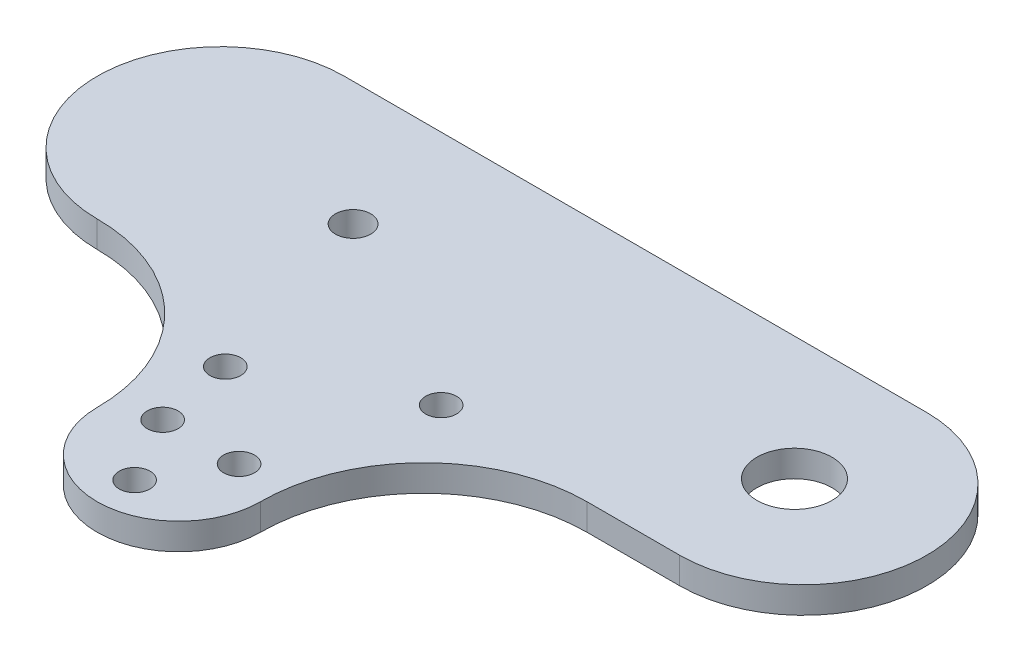
from build123d import *

# Parameters (mm, degrees)
SKETCH_1_W          = 80
SKETCH_1_H          = 28
SKETCH_1_R          = 4.25
SKETCH_1_R_2        = 2
EXTRUDE_1_DEPTH     = 3
FILLET_2_RADIUS     = 14
FILLET_2_LENGTH     = 3
EXTRUDE_3_DEPTH     = 3
SKETCH_5_W          = 18.5
SKETCH_5_H          = 18.5
EXTRUDE_4_DEPTH     = 3
FILLET_3_R          = 18.5
EXTRUDE_5_DEPTH     = 3
CUT_EXTRUDE_1_REACH = 70.323
SKETCH_10_R         = 1.75


with BuildPart() as part:
    # 草图1 → 凸台-拉伸1 (new body)
    with BuildSketch(Plane(origin=(0, 0, 0), x_dir=(1, 0, 0), z_dir=(0, 1, 0))):
        Rectangle(SKETCH_1_W, SKETCH_1_H)
        with Locations(Location((25, 0, 0), (0, 0, 270))):
            Circle(SKETCH_1_R, mode=Mode.SUBTRACT)
        with Locations(Location((-25, 0, 0), (0, 0, 270))):
            Circle(SKETCH_1_R_2, mode=Mode.SUBTRACT)
    extrude(amount=EXTRUDE_1_DEPTH)

    # 圆角2: full round fillet: the end face becomes a half cylinder, R = half its width
    fillet_2_face = Plane((40, 1.5, 0), x_dir=(0, -1, 0), z_dir=(1, 0, 0))  # on the end face: x along it, z out of the body
    fillet_2_slab = fillet_2_face.offset(-FILLET_2_RADIUS / 2) * Box(FILLET_2_LENGTH, 2 * FILLET_2_RADIUS, FILLET_2_RADIUS, mode=Mode.PRIVATE)  # the body's end, R deep
    fillet_2_round = Plane((26, 1.5, 0), x_dir=(1, 0, 0), z_dir=(0, -1, 0)) * Cylinder(FILLET_2_RADIUS, FILLET_2_LENGTH, mode=Mode.PRIVATE)  # its axis R under the face
    add(fillet_2_slab - fillet_2_round, mode=Mode.SUBTRACT)

    # 草图4 → 凸台-拉伸3 (add)
    with BuildSketch(Plane.XZ):
        with BuildLine():
            Line((-40, 14), (-40, -14))
            ThreePointArc((-40, -14), (-54, 0), (-40, 14))
        make_face()
    extrude(amount=-EXTRUDE_3_DEPTH)

    # 草图5 → 凸台-拉伸4 (add)
    with BuildSketch(Plane(origin=(0, 0, 0), x_dir=(-1, 0, 0), z_dir=(0, -1, 0))):
        with Locations((12.25, -23.25)):
            Rectangle(SKETCH_5_W, SKETCH_5_H)
    extrude(amount=-EXTRUDE_4_DEPTH)

    # 圆角3
    fillet_3_edges = [part.edges().sort_by_distance(p)[0] for p in [
        (-21.5, 1.5, 14),
        (-3, 1.5, 14),
    ]]
    fillet(fillet_3_edges, radius=FILLET_3_R - 0.0001)  # a hair under: the kernel refuses the full size

    # 草图6 → 凸台-拉伸5 (add)
    with BuildSketch(Plane.XZ):
        with BuildLine():
            Line((-21.5, 32.5), (-3, 32.5))
            ThreePointArc((-3, 32.5), (-12.25, 41.75), (-21.5, 32.5))
        make_face()
    extrude(amount=-EXTRUDE_5_DEPTH)

    # 草图10 → 切除-拉伸1 (cut, up to next)
    with BuildSketch(Plane.XZ, mode=Mode.PRIVATE) as cut_extrude_1_sk1:
        with Locations(Location((-12.25, 37.5, 0), (0, 0, 270))):
            Circle(SKETCH_10_R)
    cut_extrude_1_tool1 = extrude(cut_extrude_1_sk1.sketch, amount=-CUT_EXTRUDE_1_REACH, mode=Mode.PRIVATE) & part.part
    # 草图10 → 切除-拉伸1 (cut, up to next)
    with BuildSketch(Plane.XZ, mode=Mode.PRIVATE) as cut_extrude_1_sk2:
        with Locations(Location((-7.919872981, 30, 0), (0, 0, 270))):
            Circle(SKETCH_10_R)
    cut_extrude_1_tool2 = extrude(cut_extrude_1_sk2.sketch, amount=-CUT_EXTRUDE_1_REACH, mode=Mode.PRIVATE) & part.part
    # 草图10 → 切除-拉伸1 (cut, up to next)
    with BuildSketch(Plane.XZ, mode=Mode.PRIVATE) as cut_extrude_1_sk3:
        with Locations(Location((-16.580127019, 30, 0), (0, 0, 270))):
            Circle(SKETCH_10_R)
    cut_extrude_1_tool3 = extrude(cut_extrude_1_sk3.sketch, amount=-CUT_EXTRUDE_1_REACH, mode=Mode.PRIVATE) & part.part
    # 草图10 → 切除-拉伸1 (cut, up to next)
    with BuildSketch(Plane.XZ, mode=Mode.PRIVATE) as cut_extrude_1_sk4:
        with Locations(Location((-18.244078093, 21.233684631, 0), (0, 0, 270))):
            Circle(SKETCH_10_R)
    cut_extrude_1_tool4 = extrude(cut_extrude_1_sk4.sketch, amount=-CUT_EXTRUDE_1_REACH, mode=Mode.PRIVATE) & part.part
    # 草图10 → 切除-拉伸1 (cut, up to next)
    with BuildSketch(Plane.XZ, mode=Mode.PRIVATE) as cut_extrude_1_sk5:
        with Locations(Location((-2.240350538, 12.7860315, 0), (0, 0, 270))):
            Circle(SKETCH_10_R)
    cut_extrude_1_tool5 = extrude(cut_extrude_1_sk5.sketch, amount=-CUT_EXTRUDE_1_REACH, mode=Mode.PRIVATE) & part.part
    add(cut_extrude_1_tool1.solids().sort_by_distance((-12.25, 0, 37.5))[0], mode=Mode.SUBTRACT)
    add(cut_extrude_1_tool2.solids().sort_by_distance((-7.919873, 0, 30))[0], mode=Mode.SUBTRACT)
    add(cut_extrude_1_tool3.solids().sort_by_distance((-16.580127, 0, 30))[0], mode=Mode.SUBTRACT)
    add(cut_extrude_1_tool4.solids().sort_by_distance((-18.244078, 0, 21.233685))[0], mode=Mode.SUBTRACT)
    add(cut_extrude_1_tool5.solids().sort_by_distance((-2.240351, 0, 12.786031))[0], mode=Mode.SUBTRACT)


solid = part.part
